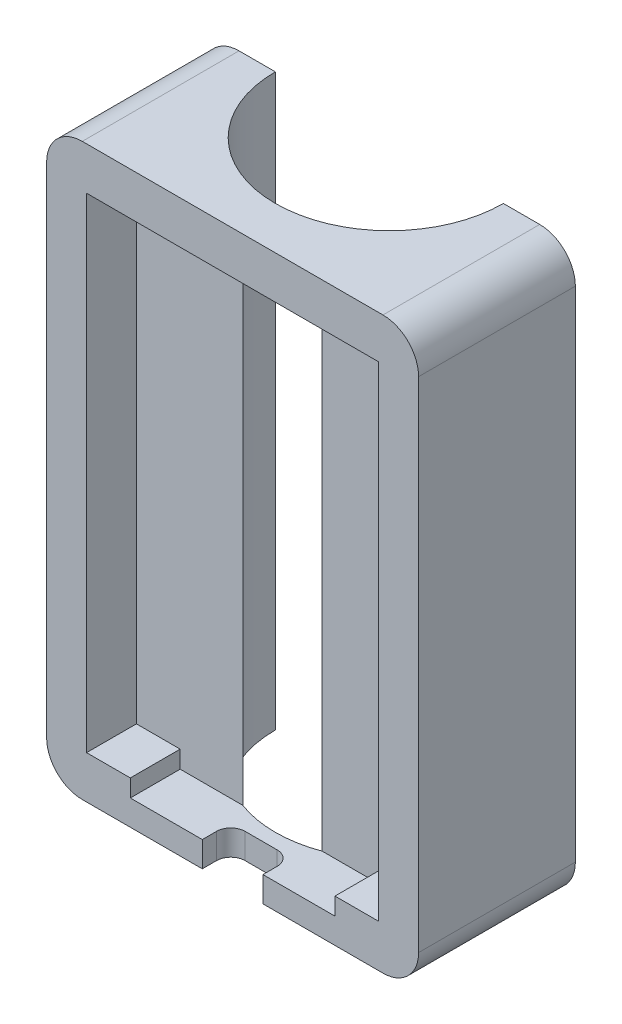
from build123d import *

# Parameters (mm, degrees)
ESQUISSE1_W             = 52.2
ESQUISSE1_H             = 80
BOSS_EXTRU_2_DEPTH      = 22
ESQUISSE3_W             = 48.72
ESQUISSE3_H             = 72.8776
ENL_V_MAT_EXTRU_1_DEPTH = 5
CONG_1_R                = 10
CONG_2_R                = 5
BOSS_EXTRU_4_DEPTH      = 5
ESQUISSE2_R             = 16
ENL_V_MAT_EXTRU_3_DEPTH = 93.647092521
ENL_V_MAT_EXTRU_5_DEPTH = 2
ESQUISSE8_W             = 8.51
ESQUISSE8_H             = 3.5612
ENL_V_MAT_EXTRU_6_DEPTH = 4
CONG_3_R                = 2


with BuildPart() as part:
    # Esquisse1 → Boss.-Extru.2 (new body)
    with BuildSketch(Plane.XY):
        with Locations((-15.124795362, -42.006460905)):
            Rectangle(ESQUISSE1_W, ESQUISSE1_H)
    extrude(amount=BOSS_EXTRU_2_DEPTH)

    # Esquisse3 → Enlèv. mat.-Extru.1 (cut)
    with BuildSketch(Plane.XY.offset(22)):
        with Locations((-15.124795362, -42.006460905)):
            Rectangle(ESQUISSE3_W, ESQUISSE3_H)
    extrude(amount=-ENL_V_MAT_EXTRU_1_DEPTH, mode=Mode.SUBTRACT)

    # Congé1
    cong_1_edges = [part.edges().sort_by_distance(p)[0] for p in [
        (-39.484795362, -78.445260905, 19.5),
        (9.235204638, -78.445260905, 19.5),
        (9.235204638, -5.567660905, 19.5),
        (-39.484795362, -5.567660905, 19.5),
    ]]
    fillet(cong_1_edges, radius=CONG_1_R)

    # Congé2
    cong_2_edges = [part.edges().sort_by_distance(p)[0] for p in [
        (-41.224795362, -82.006460905, 11),
        (10.975204638, -82.006460905, 11),
        (10.975204638, -2.006460905, 11),
        (-41.224795362, -2.006460905, 11),
    ]]
    fillet(cong_2_edges, radius=CONG_2_R)

    # Esquisse5 → Boss.-Extru.4 (add)
    with BuildSketch(Plane.XY.offset(17)):
        with BuildLine():
            Line((-35.624795362, -15.567660905), (-35.624795362, -8.006460905))
            Line((-35.624795362, -8.006460905), (-29.484795362, -8.006460905))
            Line((-29.484795362, -8.006460905), (-0.764795362, -8.006460905))
            Line((-0.764795362, -8.006460905), (5.375204638, -8.006460905))
            Line((5.375204638, -8.006460905), (5.375204638, -15.567660905))
            Line((5.375204638, -15.567660905), (5.375204638, -68.445260905))
            Line((5.375204638, -68.445260905), (5.375204638, -76.006460905))
            Line((5.375204638, -76.006460905), (-0.764795362, -76.006460905))
            Line((-0.764795362, -76.006460905), (-0.764795362, -78.445260905))
            ThreePointArc((-0.764795362, -78.445260905), (6.30627245, -75.516328717), (9.235204638, -68.445260905))
            Line((9.235204638, -68.445260905), (9.235204638, -15.567660905))
            ThreePointArc((9.235204638, -15.567660905), (6.30627245, -8.496593093), (-0.764795362, -5.567660905))
            Line((-0.764795362, -5.567660905), (-29.484795362, -5.567660905))
            ThreePointArc((-29.484795362, -5.567660905), (-36.555863174, -8.496593093), (-39.484795362, -15.567660905))
            Line((-39.484795362, -15.567660905), (-39.484795362, -68.445260905))
            ThreePointArc((-39.484795362, -68.445260905), (-36.555863174, -75.516328717), (-29.484795362, -78.445260905))
            Line((-29.484795362, -78.445260905), (-29.484795362, -76.006460905))
            Line((-29.484795362, -76.006460905), (-35.624795362, -76.006460905))
            Line((-35.624795362, -76.006460905), (-35.624795362, -68.445260905))
            Line((-35.624795362, -68.445260905), (-35.624795362, -15.567660905))
        make_face()
    extrude(amount=BOSS_EXTRU_4_DEPTH)

    # Esquisse2 → Enlèv. mat.-Extru.3 (cut, through all)
    with BuildSketch(Plane.XZ.offset(82.006460905)):
        with Locations((-15.124795362, 0)):
            Circle(ESQUISSE2_R)
    extrude(amount=-ENL_V_MAT_EXTRU_3_DEPTH, mode=Mode.SUBTRACT)

    # Esquisse7 → Enlèv. mat.-Extru.5 (cut)
    with BuildSketch(Plane.XY.offset(17)):
        Polygon((-35.624795362, -8.006460905), (5.375204638, -8.006460905), (5.375204638, -76.006460905), (-0.764795362, -76.006460905), (-0.764795362, -78.445260905), (-29.484795362, -78.445260905), (-29.484795362, -76.006460905), (-35.624795362, -76.006460905), align=None)
    extrude(amount=-ENL_V_MAT_EXTRU_5_DEPTH, mode=Mode.SUBTRACT)

    # Esquisse8 → Enlèv. mat.-Extru.6 (cut)
    with BuildSketch(Plane.XY.offset(22)):
        with Locations((-15.124795362, -80.225860905)):
            Rectangle(ESQUISSE8_W, ESQUISSE8_H)
    extrude(amount=-ENL_V_MAT_EXTRU_6_DEPTH, mode=Mode.SUBTRACT)

    # Congé3
    cong_3_edges = [part.edges().sort_by_distance(p)[0] for p in [
        (-10.869795362, -80.225860905, 18),
        (-19.379795362, -80.225860905, 18),
    ]]
    fillet(cong_3_edges, radius=CONG_3_R)


solid = part.part
